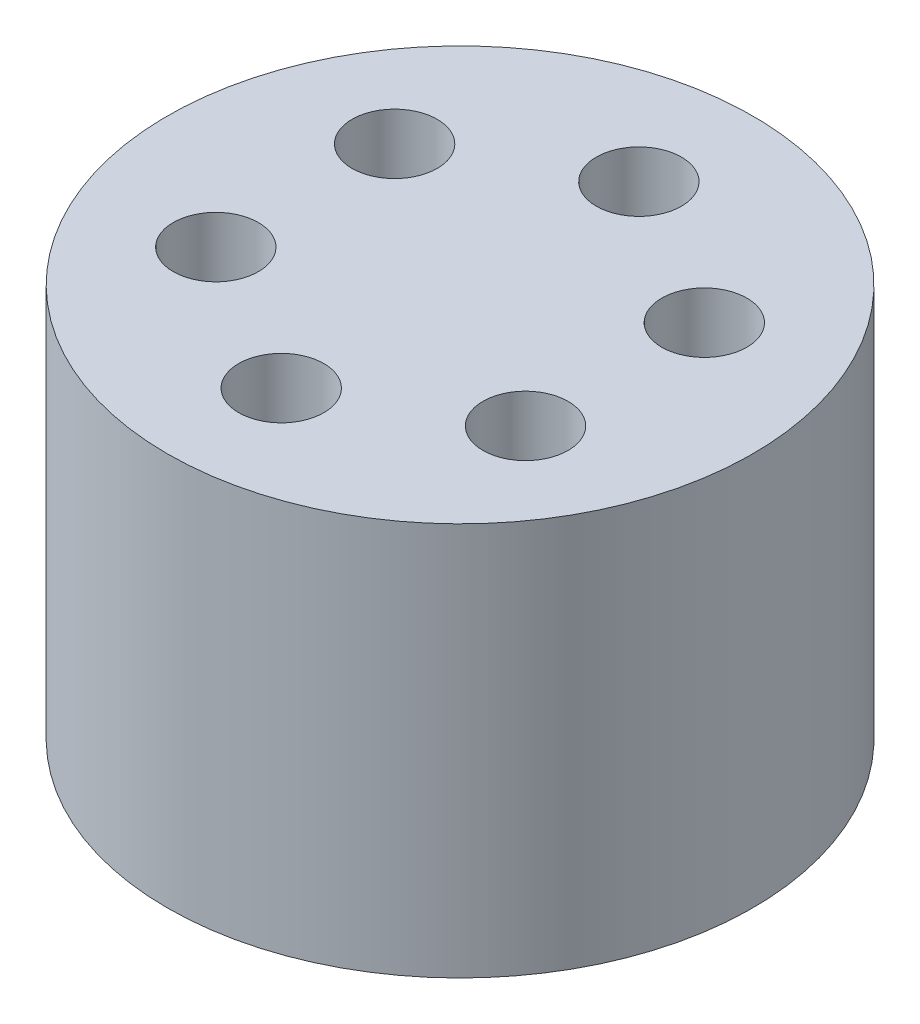
from build123d import *

# Parameters (mm, degrees)
SKETCH1_R           = 18.9
BOSS_EXTRUDE1_DEPTH = 25.4
SKETCH2_R           = 2.75
CUT_EXTRUDE1_DEPTH  = 25.4


with BuildPart() as part:
    # Sketch1 → Boss-Extrude1 (new body)
    with BuildSketch(Plane(origin=(0, 0, 0), x_dir=(1, 0, 0), z_dir=(0, 1, 0))):
        Circle(SKETCH1_R)
    extrude(amount=BOSS_EXTRUDE1_DEPTH)

    # Sketch2 → Cut-Extrude1 (cut)
    with BuildSketch(Plane(origin=(0, 25.4, 0), x_dir=(1, 0, 0), z_dir=(0, 1, 0))):
        with Locations((0, 11.547005384)):
            Circle(SKETCH2_R)
        with Locations((-10, 5.773502692)):
            Circle(SKETCH2_R)
        with Locations((10, 5.773502692)):
            Circle(SKETCH2_R)
        with Locations((-10, -5.773502692)):
            Circle(SKETCH2_R)
        with Locations((10, -5.773502692)):
            Circle(SKETCH2_R)
        with Locations((0, -11.547005384)):
            Circle(SKETCH2_R)
    extrude(amount=-CUT_EXTRUDE1_DEPTH, mode=Mode.SUBTRACT)


solid = part.part
